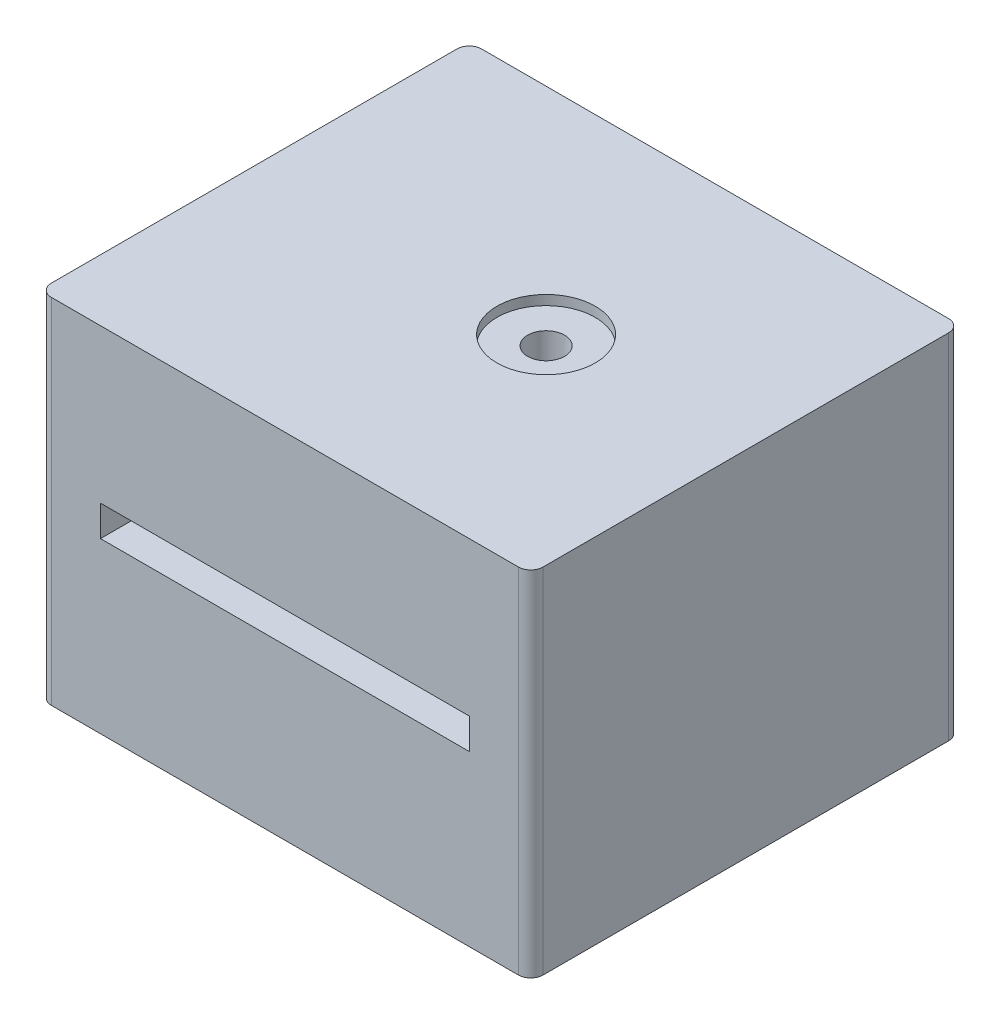
from build123d import *

# Parameters (mm, degrees)
BOX_EXTRUDE_DEPTH             = 100
BOX_EXTRUDE_DEPTH_BACK        = 15
SKETCH2_W                     = 160
SKETCH2_H                     = 140
BOX_INNER_CUT_START           = -20
SKETCH3_W                     = 120
SKETCH3_H                     = 100
BOX_INNER_CUT_DEPTH           = 40
SHAFT_CUT_START               = -60
SKETCH6_R                     = 6
SHAFT_CUT_DEPTH               = 40
BEARING_CUTS_INSIDE_BOX_START = -60
SKETCH9_R                     = 8
SKETCH9_R_2                   = 16
BEARING_CUTS_INSIDE_BOX_DEPTH = 10
SKETCH11_W                    = 120
SKETCH11_H                    = 10
SCISSOR_CUT_DEPTH             = 20
SKETCH12_R                    = 16
MOTOR_HOLE_CUT_DEPTH          = 3.15
RIGHT_SHAFT_LID_CUT_REACH     = 156.306
SKETCH15_R                    = 6
LEFT_BEARING_LID_CUT_START    = -10
SKETCH18_R                    = 8
LEFT_BEARING_LID_CUT_DEPTH    = 10
OUTER_EDGES_FILLET_R          = 4


with BuildPart() as part:
    # Sketch2 → BOX_EXTRUDE (new, two sides: drawn at the far end of the back side and taken through both)
    with BuildSketch(Plane(origin=(0, 0, 0), x_dir=(1, 0, 0), z_dir=(0, 1, 0)).offset(-BOX_EXTRUDE_DEPTH_BACK)):
        Rectangle(SKETCH2_W, SKETCH2_H)
    extrude(amount=BOX_EXTRUDE_DEPTH + BOX_EXTRUDE_DEPTH_BACK)

    # Sketch3 → BOX_INNER_CUT (cut)
    with BuildSketch(Plane(origin=(0, 100, 0), x_dir=(1, 0, 0), z_dir=(0, 1, 0)).offset(BOX_INNER_CUT_START)):
        Rectangle(SKETCH3_W, SKETCH3_H)
    extrude(amount=-BOX_INNER_CUT_DEPTH, mode=Mode.SUBTRACT)

    # Sketch6 → SHAFT_CUT (cut)
    with BuildSketch(Plane(origin=(0, 100, 0), x_dir=(1, 0, 0), z_dir=(0, 1, 0)).offset(SHAFT_CUT_START)):
        with Locations((15, 0)):
            Circle(SKETCH6_R)
        with Locations((-15, 0)):
            Circle(SKETCH6_R)
    extrude(amount=-SHAFT_CUT_DEPTH, mode=Mode.SUBTRACT)

    # Sketch9 → BEARING_CUTS_INSIDE_BOX (cut)
    with BuildSketch(Plane(origin=(0, 100, 0), x_dir=(1, 0, 0), z_dir=(0, 1, 0)).offset(BEARING_CUTS_INSIDE_BOX_START)):
        with Locations((15, 0)):
            Circle(SKETCH9_R)
        with Locations((-15, 0)):
            Circle(SKETCH9_R_2)
    extrude(amount=-BEARING_CUTS_INSIDE_BOX_DEPTH, mode=Mode.SUBTRACT)

    # Sketch11 → SCISSOR_CUT (cut)
    with BuildSketch(Plane.XY.offset(70)):
        with Locations((0, 45)):
            Rectangle(SKETCH11_W, SKETCH11_H)
    extrude(amount=-SCISSOR_CUT_DEPTH, mode=Mode.SUBTRACT)

    # Sketch12 → MOTOR_HOLE_CUT (cut)
    with BuildSketch(Plane(origin=(0, 100, 0), x_dir=(1, 0, 0), z_dir=(0, 1, 0))):
        with Locations((15, 0)):
            Circle(SKETCH12_R)
    extrude(amount=-MOTOR_HOLE_CUT_DEPTH, mode=Mode.SUBTRACT)

    # Sketch15 → RIGHT_SHAFT_LID_CUT (cut, up to next)
    with BuildSketch(Plane(origin=(0, 96.85, 0), x_dir=(1, 0, 0), z_dir=(0, 1, 0)), mode=Mode.PRIVATE) as right_shaft_lid_cut_sk1:
        with Locations((15, 0)):
            Circle(SKETCH15_R)
    right_shaft_lid_cut_tool1 = extrude(right_shaft_lid_cut_sk1.sketch, amount=-RIGHT_SHAFT_LID_CUT_REACH, mode=Mode.PRIVATE) & part.part
    add(right_shaft_lid_cut_tool1.solids().sort_by_distance((15, 96.85, 0))[0], mode=Mode.SUBTRACT)

    # Sketch18 → LEFT_BEARING_LID_CUT (cut)
    with BuildSketch(Plane(origin=(0, 100, 0), x_dir=(1, 0, 0), z_dir=(0, 1, 0)).offset(LEFT_BEARING_LID_CUT_START)):
        with Locations((-15, 0)):
            Circle(SKETCH18_R)
    extrude(amount=-LEFT_BEARING_LID_CUT_DEPTH, mode=Mode.SUBTRACT)

    # OUTER_EDGES_FILLET
    outer_edges_fillet_edges = [part.edges().sort_by_distance(p)[0] for p in [
        (-80, 42.5, -70),
        (80, 42.5, -70),
        (80, 42.5, 70),
        (-80, 42.5, 70),
    ]]
    fillet(outer_edges_fillet_edges, radius=OUTER_EDGES_FILLET_R)


solid = part.part
